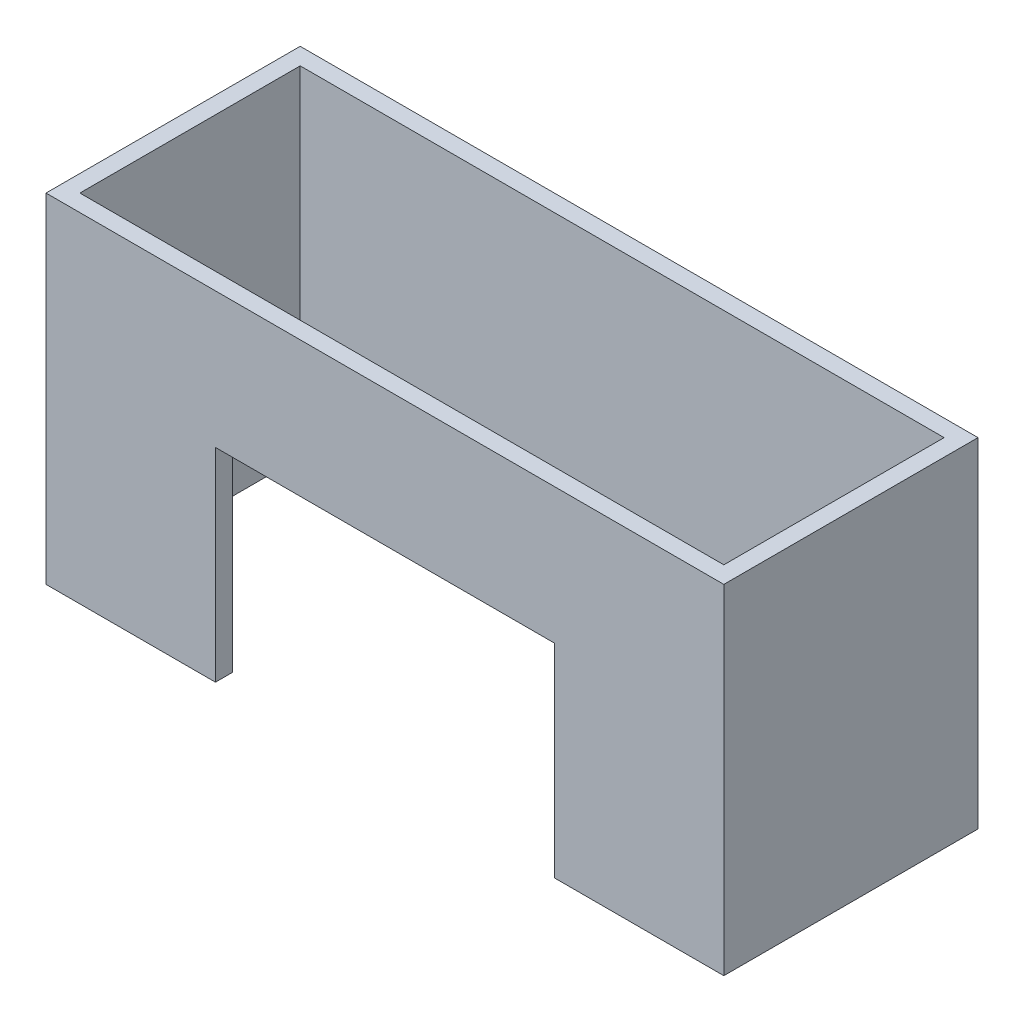
from build123d import *

# Parameters (mm, degrees)
SKETCH1_W           = 400
SKETCH1_H           = 150
BOSS_EXTRUDE1_DEPTH = 200
SKETCH2_W           = 380
SKETCH2_H           = 130
CUT_EXTRUDE1_DEPTH  = 200
SKETCH3_W           = 200
SKETCH3_H           = 120
CUT_EXTRUDE2_DEPTH  = 20


with BuildPart() as part:
    # Sketch1 → Boss-Extrude1 (new body)
    with BuildSketch(Plane(origin=(0, 0, 0), x_dir=(1, 0, 0), z_dir=(0, 1, 0))):
        Rectangle(SKETCH1_W, SKETCH1_H)
    extrude(amount=BOSS_EXTRUDE1_DEPTH)

    # Sketch2 → Cut-Extrude1 (cut)
    with BuildSketch(Plane(origin=(0, 200, 0), x_dir=(1, 0, 0), z_dir=(0, 1, 0))):
        Rectangle(SKETCH2_W, SKETCH2_H)
    extrude(amount=-CUT_EXTRUDE1_DEPTH, mode=Mode.SUBTRACT)

    # Sketch3 → Cut-Extrude2 (cut)
    with BuildSketch(Plane.XY.offset(75)):
        with Locations((0, 60)):
            Rectangle(SKETCH3_W, SKETCH3_H)
    extrude(amount=-CUT_EXTRUDE2_DEPTH, mode=Mode.SUBTRACT)


solid = part.part
